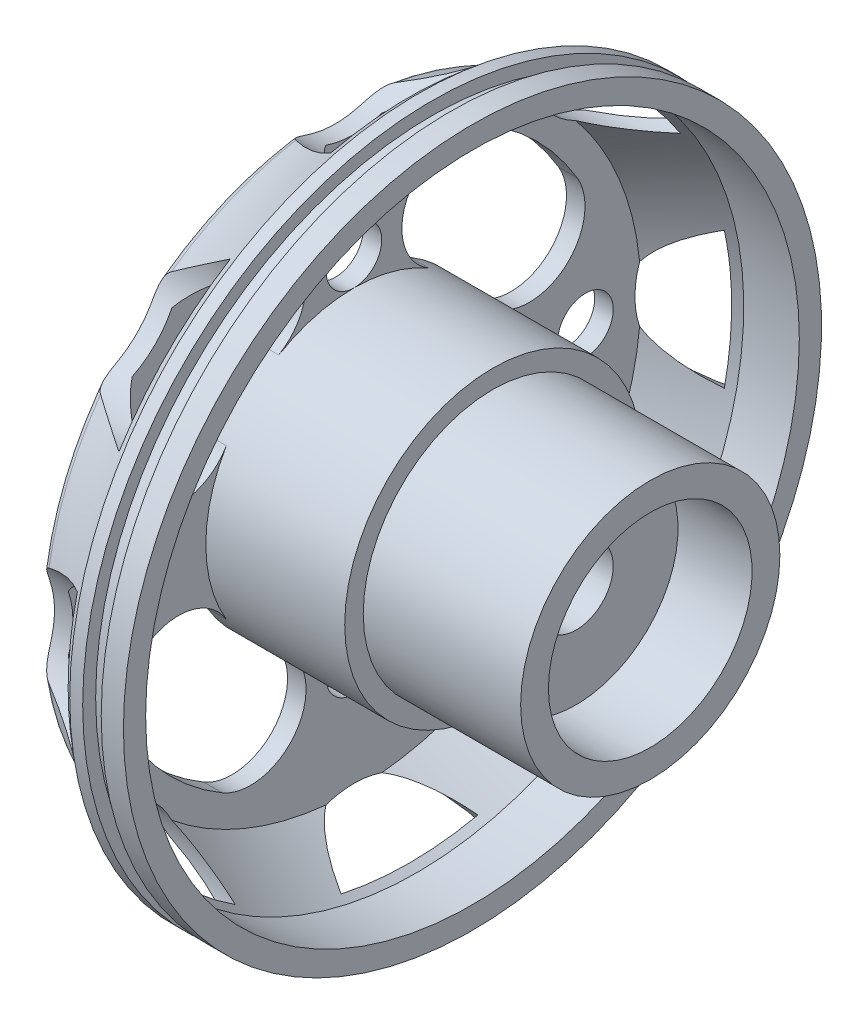
from build123d import *

# Parameters (mm, degrees)
FILLET1_R          = 1
CUT_EXTRUDE3_START = -4
CUT_EXTRUDE3_DEPTH = 4
SKETCH3_R          = 1.5
CUT_EXTRUDE4_DEPTH = 4


with BuildPart() as part:
    # Sketch1 → Revolve1 (revolve)
    with BuildSketch(Plane.XY):
        with BuildLine():
            Line((17, 5.5), (13, 5.5))
            Line((13, 5.5), (13, 2))
            Line((13, 2), (4, 2))
            Line((4, 2), (4, 5.5))
            Line((4, 5.5), (0, 5.5))
            Line((0, 5.5), (0, 16))
            ThreePointArc((0, 16), (2.354595347, 17.259849452), (4.5, 18.85))
            Line((4.5, 18.85), (5.2, 18.85))
            Line((5.2, 18.85), (5.2, 18.15))
            Line((5.2, 18.15), (6.2, 18.15))
            Line((6.2, 18.15), (6.2, 18.85))
            Line((6.2, 18.85), (7.4, 18.85))
            Line((7.4, 18.85), (7.4, 17.65))
            Line((7.4, 17.65), (4.4, 17.65))
            Line((4.4, 17.65), (1, 15.5))
            Line((1, 15.5), (1, 8))
            Line((1, 8), (8.5, 8))
            Line((8.5, 8), (8.5, 7))
            Line((8.5, 7), (17, 7))
            Line((17, 7), (17, 5.5))
        make_face()
    revolve(axis=Axis((0, 0, 0), (1, 0, 0)))

    # Fillet1
    fillet1_edges = [part.edges().sort_by_distance(p)[0] for p in [
        (0, -16, 0),
    ]]
    fillet(fillet1_edges, radius=FILLET1_R)

    # Sketch2 → Cut-Extrude3 (cut)
    with BuildSketch(Plane.ZY.offset(CUT_EXTRUDE3_START)):
        with BuildLine():
            ThreePointArc((12.06001849, 7.110271022), (9.899494937, 9.899494937), (7.110271022, 12.06001849))
            ThreePointArc((7.110271022, 12.06001849), (3.002351841, 10.999358319), (4.063012013, 6.891439137))
            ThreePointArc((4.063012013, 6.891439137), (5.656854249, 5.656854249), (6.891439137, 4.063012013))
            ThreePointArc((6.891439137, 4.063012013), (10.999358319, 3.002351841), (12.06001849, 7.110271022))
        make_face()
        with BuildLine():
            ThreePointArc((4.063012013, -6.891439137), (5.656854249, -5.656854249), (6.891439137, -4.063012013))
            ThreePointArc((6.891439137, -4.063012013), (10.999358319, -3.002351841), (12.06001849, -7.110271022))
            ThreePointArc((12.06001849, -7.110271022), (9.899494937, -9.899494937), (7.110271022, -12.06001849))
            ThreePointArc((7.110271022, -12.06001849), (3.002351841, -10.999358319), (4.063012013, -6.891439137))
        make_face()
        with BuildLine():
            ThreePointArc((-6.891439137, -4.063012013), (-5.656854249, -5.656854249), (-4.063012013, -6.891439137))
            ThreePointArc((-4.063012013, -6.891439137), (-3.002351841, -10.999358319), (-7.110271022, -12.06001849))
            ThreePointArc((-7.110271022, -12.06001849), (-9.899494937, -9.899494937), (-12.06001849, -7.110271022))
            ThreePointArc((-12.06001849, -7.110271022), (-10.999358319, -3.002351841), (-6.891439137, -4.063012013))
        make_face()
        with BuildLine():
            ThreePointArc((-4.063012013, 6.891439137), (-5.656854249, 5.656854249), (-6.891439137, 4.063012013))
            ThreePointArc((-6.891439137, 4.063012013), (-10.999358319, 3.002351841), (-12.06001849, 7.110271022))
            ThreePointArc((-12.06001849, 7.110271022), (-9.899494937, 9.899494937), (-7.110271022, 12.06001849))
            ThreePointArc((-7.110271022, 12.06001849), (-3.002351841, 10.999358319), (-4.063012013, 6.891439137))
        make_face()
        with BuildLine():
            ThreePointArc((9.844474172, 16.075099635), (10.728421008, 10.728421008), (16.075099635, 9.844474172))
            ThreePointArc((16.075099635, 9.844474172), (13.328962825, 13.328962825), (9.844474172, 16.075099635))
        make_face()
        with BuildLine():
            ThreePointArc((18.327906404, 4.405717516), (15.172278493, 0), (18.327906404, -4.405717516))
            ThreePointArc((18.327906404, -4.405717516), (18.85, 0), (18.327906404, 4.405717516))
        make_face()
        with BuildLine():
            ThreePointArc((16.075099635, -9.844474172), (10.728421008, -10.728421008), (9.844474172, -16.075099635))
            ThreePointArc((9.844474172, -16.075099635), (13.328962825, -13.328962825), (16.075099635, -9.844474172))
        make_face()
        with BuildLine():
            ThreePointArc((4.405717516, -18.327906404), (0, -15.172278493), (-4.405717516, -18.327906404))
            ThreePointArc((-4.405717516, -18.327906404), (0, -18.85), (4.405717516, -18.327906404))
        make_face()
        with BuildLine():
            ThreePointArc((-9.844474172, -16.075099635), (-10.728421008, -10.728421008), (-16.075099635, -9.844474172))
            ThreePointArc((-16.075099635, -9.844474172), (-13.328962825, -13.328962825), (-9.844474172, -16.075099635))
        make_face()
        with BuildLine():
            ThreePointArc((-18.327906404, -4.405717516), (-15.172278493, 0), (-18.327906404, 4.405717516))
            ThreePointArc((-18.327906404, 4.405717516), (-18.85, 0), (-18.327906404, -4.405717516))
        make_face()
        with BuildLine():
            ThreePointArc((-16.075099635, 9.844474172), (-10.728421008, 10.728421008), (-9.844474172, 16.075099635))
            ThreePointArc((-9.844474172, 16.075099635), (-13.328962825, 13.328962825), (-16.075099635, 9.844474172))
        make_face()
        with BuildLine():
            ThreePointArc((-4.405717516, 18.327906404), (0, 15.172278493), (4.405717516, 18.327906404))
            ThreePointArc((4.405717516, 18.327906404), (0, 18.85), (-4.405717516, 18.327906404))
        make_face()
    extrude(amount=CUT_EXTRUDE3_DEPTH, mode=Mode.SUBTRACT)

    # Sketch3 → Cut-Extrude4 (cut)
    with BuildSketch(Plane.ZY):
        with Locations((12.5, 0)):
            Circle(SKETCH3_R)
        with Locations((-12.5, 0)):
            Circle(SKETCH3_R)
        with Locations((0, -9.5)):
            Circle(SKETCH3_R)
        with Locations((0, 9.5)):
            Circle(SKETCH3_R)
    extrude(amount=-CUT_EXTRUDE4_DEPTH, mode=Mode.SUBTRACT)


solid = part.part
